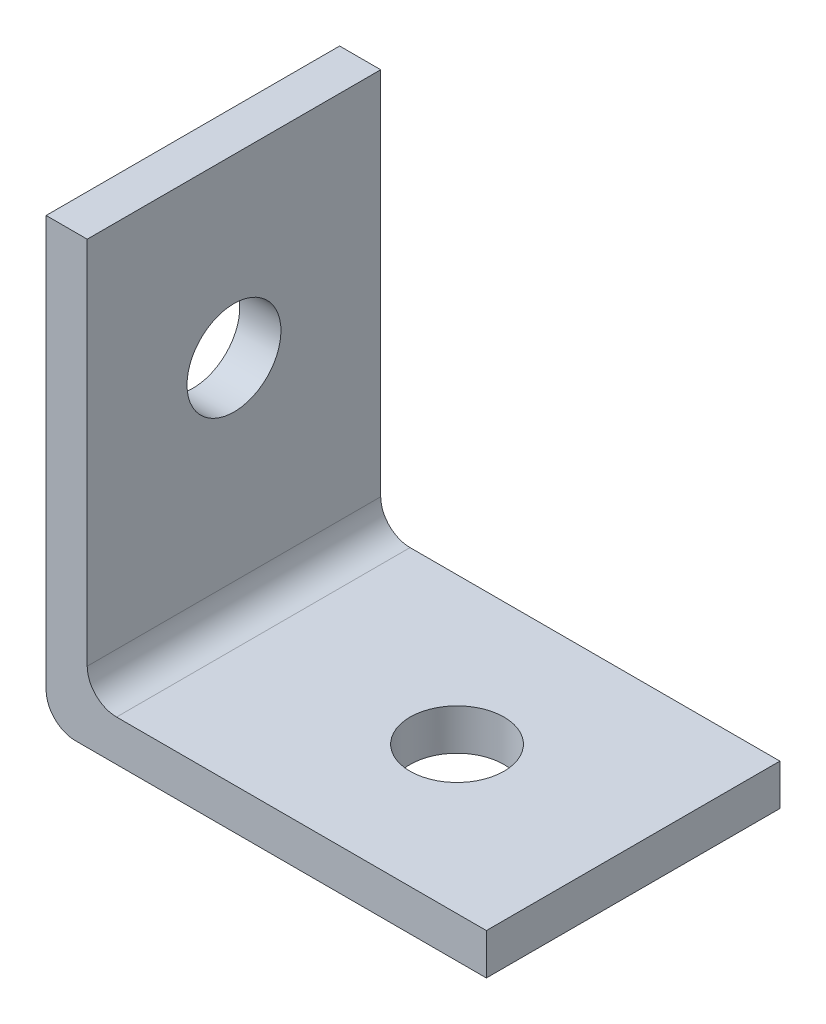
from build123d import *

# Parameters (mm, degrees)
BOSS_EXTRUDE1_DEPTH = 6.35
CUT_EXTRUDE1_REACH  = 29.679
SKETCH2_R           = 2.032
CUT_EXTRUDE2_REACH  = 29.679
SKETCH3_R           = 2.032
FILLET2_R           = 1.27
FILLET3_R           = 1.27


with BuildPart() as part:
    # Sketch1 → Boss-Extrude1 (new, symmetric)
    with BuildSketch(Plane.XY):
        Polygon((0, 0), (0, 19.05), (1.778, 19.05), (1.778, 1.778), (19.05, 1.778), (19.05, 0), align=None)
    extrude(amount=BOSS_EXTRUDE1_DEPTH, both=True)

    # Sketch2 → Cut-Extrude1 (cut, up to next)
    with BuildSketch(Plane.ZY, mode=Mode.PRIVATE) as cut_extrude1_sk1:
        with Locations((0, 11.43)):
            Circle(SKETCH2_R)
    cut_extrude1_tool1 = extrude(cut_extrude1_sk1.sketch, amount=-CUT_EXTRUDE1_REACH, mode=Mode.PRIVATE) & part.part
    add(cut_extrude1_tool1.solids().sort_by_distance((0, 11.43, 0))[0], mode=Mode.SUBTRACT)

    # Sketch3 → Cut-Extrude2 (cut, up to next)
    with BuildSketch(Plane.XZ, mode=Mode.PRIVATE) as cut_extrude2_sk1:
        with Locations((11.43, 0)):
            Circle(SKETCH3_R)
    cut_extrude2_tool1 = extrude(cut_extrude2_sk1.sketch, amount=-CUT_EXTRUDE2_REACH, mode=Mode.PRIVATE) & part.part
    add(cut_extrude2_tool1.solids().sort_by_distance((11.43, 0, 0))[0], mode=Mode.SUBTRACT)

    # Fillet2
    fillet2_edges = [part.edges().sort_by_distance(p)[0] for p in [
        (1.778, 1.778, 0),
    ]]
    fillet(fillet2_edges, radius=FILLET2_R)

    # Fillet3
    fillet3_edges = [part.edges().sort_by_distance(p)[0] for p in [
        (0, 0, 0),
    ]]
    fillet(fillet3_edges, radius=FILLET3_R)


solid = part.part
